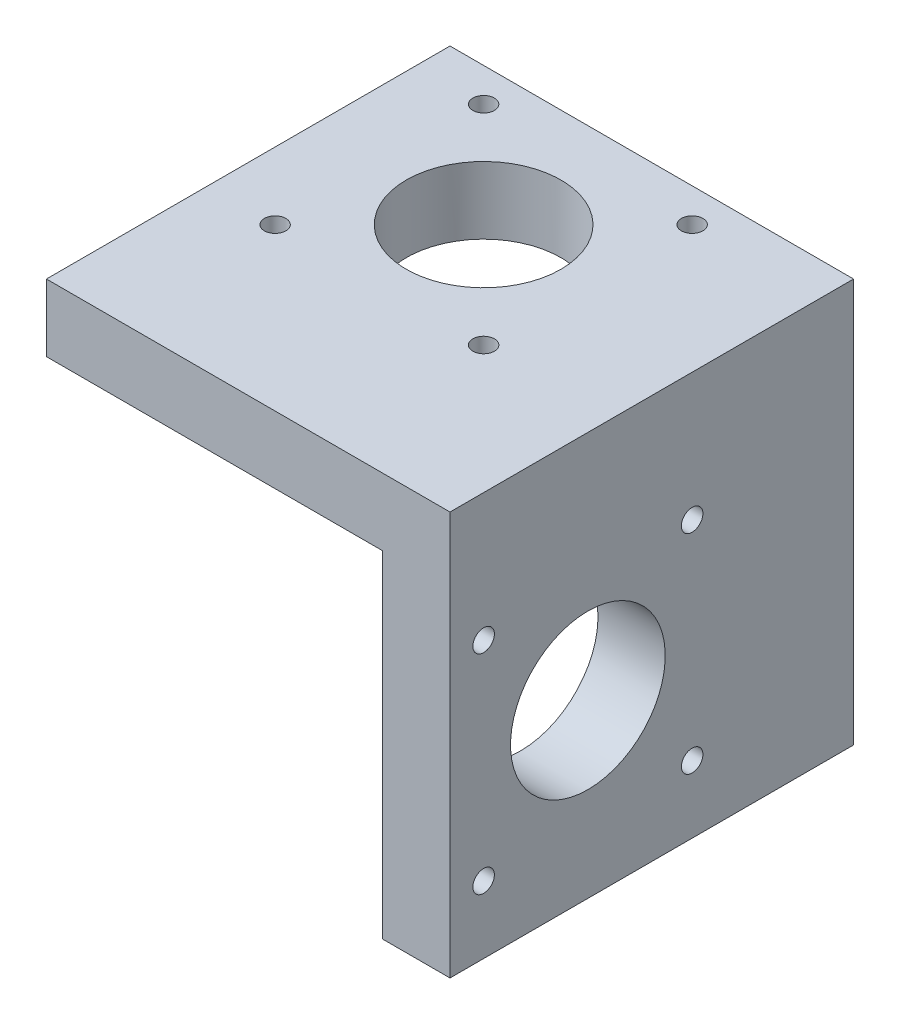
from build123d import *

# Parameters (mm, degrees)
EXTRUDE_1_DEPTH     = 60
SKETCH_2_R          = 1.6
SKETCH_2_R_2        = 11.5
CUT_EXTRUDE_1_DEPTH = 60
SKETCH_4_R          = 1.6
SKETCH_4_R_2        = 11.5
CUT_EXTRUDE_2_DEPTH = 60


with BuildPart() as part:
    # 草图1 → 凸台-拉伸1 (new body)
    with BuildSketch(Plane.XY):
        Polygon((2.5, 20.073529412), (-47.5, 20.073529412), (-47.5, 10.073529412), (2.5, 10.073529412), (2.5, -39.926470588), (12.5, -39.926470588), (12.5, 10.073529412), (12.5, 20.073529412), align=None)
    extrude(amount=EXTRUDE_1_DEPTH)

    # 草图2 → 切除-拉伸1 (cut)
    with BuildSketch(Plane.XZ.offset(-10.073529412)):
        with Locations((-37.5, 36)):
            Circle(SKETCH_2_R)
        with Locations((-37.5, 5)):
            Circle(SKETCH_2_R)
        with Locations((-6.5, 5)):
            Circle(SKETCH_2_R)
        with Locations((-6.5, 36)):
            Circle(SKETCH_2_R)
        with Locations((-22, 20.5)):
            Circle(SKETCH_2_R_2)
    extrude(amount=-CUT_EXTRUDE_1_DEPTH, mode=Mode.SUBTRACT)

    # 草图4 → 切除-拉伸2 (cut)
    with BuildSketch(Plane.ZY.offset(-2.5)):
        with Locations((24, 1.073529412)):
            Circle(SKETCH_4_R)
        with Locations((24, -29.926470588)):
            Circle(SKETCH_4_R)
        with Locations((55, -29.926470588)):
            Circle(SKETCH_4_R)
        with Locations((55, 1.073529412)):
            Circle(SKETCH_4_R)
        with Locations((39.5, -14.426470588)):
            Circle(SKETCH_4_R_2)
    extrude(amount=-CUT_EXTRUDE_2_DEPTH, mode=Mode.SUBTRACT)


solid = part.part
